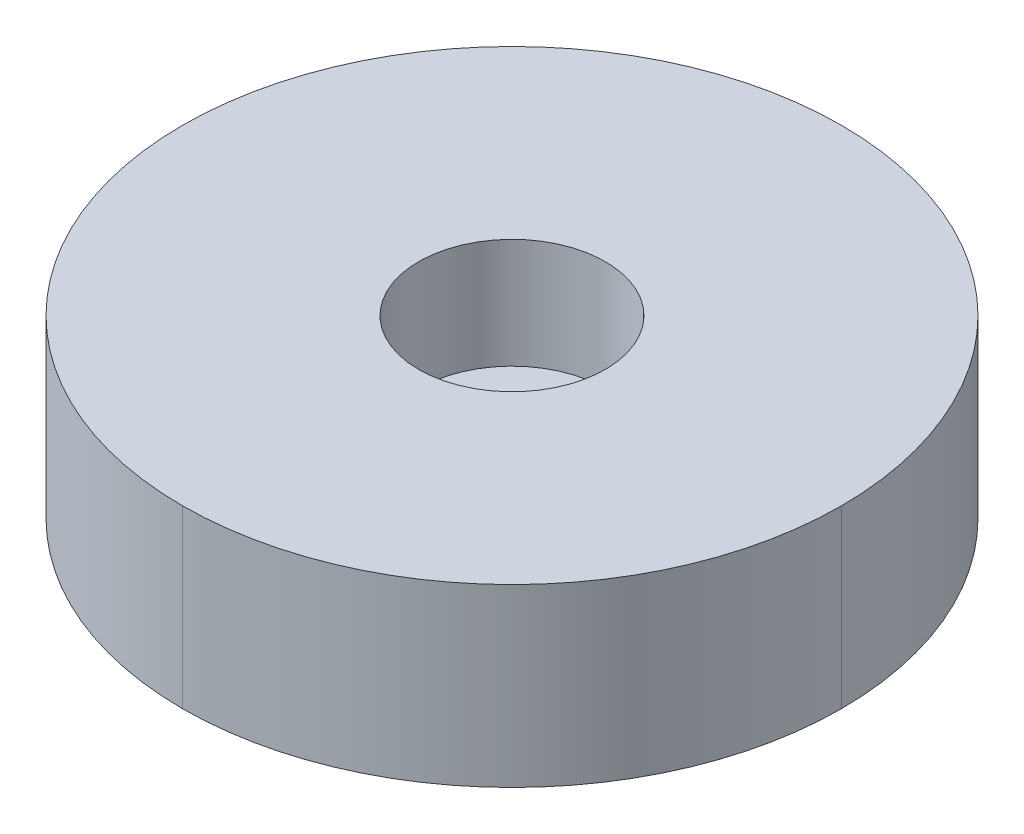
from build123d import *

# Parameters (mm, degrees)
SKETCH1_W           = 30
SKETCH1_H           = 30
BOSS_EXTRUDE3_DEPTH = 8
SKETCH3_R           = 4.25
CUT_EXTRUDE2_DEPTH  = 5
FILLET2_R           = 15


with BuildPart() as part:
    # Sketch1 → Boss-Extrude3 (new body)
    with BuildSketch(Plane(origin=(0, 0, 0), x_dir=(1, 0, 0), z_dir=(0, 1, 0))):
        with Locations((-4.26121372, -7.941952507)):
            Rectangle(SKETCH1_W, SKETCH1_H)
    extrude(amount=BOSS_EXTRUDE3_DEPTH)

    # Sketch3 → Cut-Extrude2 (cut)
    with BuildSketch(Plane(origin=(0, 8, 0), x_dir=(1, 0, 0), z_dir=(0, 1, 0))):
        with Locations(Location((-4.26121372, -7.941952507, 0), (0, 0, 270))):
            Circle(SKETCH3_R)
    extrude(amount=-CUT_EXTRUDE2_DEPTH, mode=Mode.SUBTRACT)

    # Fillet2
    fillet2_edges = [part.edges().sort_by_distance(p)[0] for p in [
        (10.73878628, 4, 22.941952507),
        (-19.26121372, 4, 22.941952507),
        (-19.26121372, 4, -7.058047493),
        (10.73878628, 4, -7.058047493),
    ]]
    fillet(fillet2_edges, radius=FILLET2_R - 0.0001)  # a hair under: the kernel refuses the full size


solid = part.part
